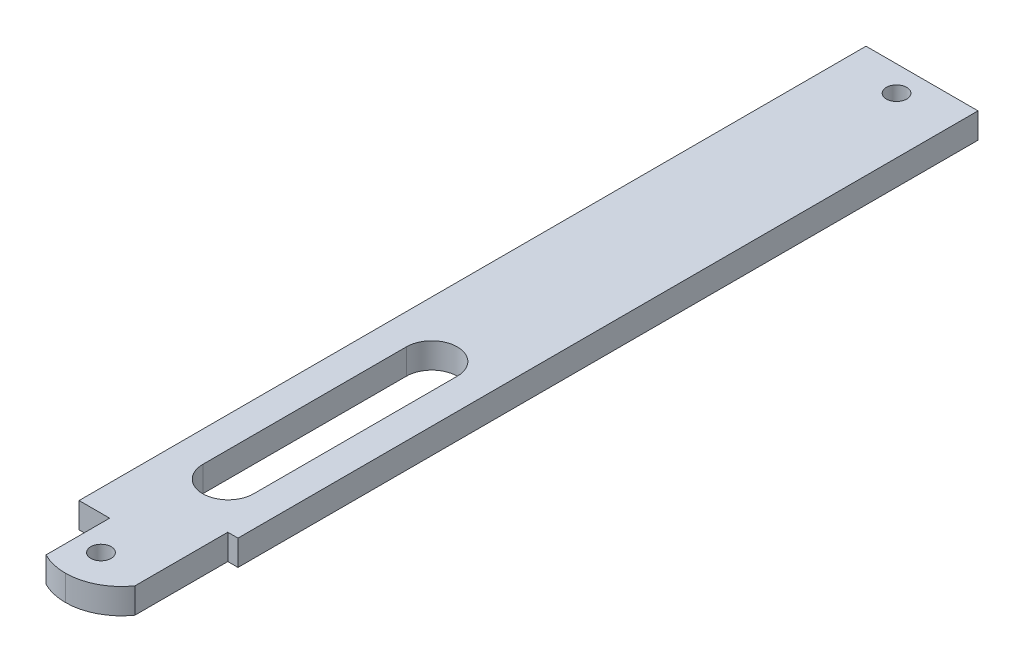
from build123d import *

# Parameters (mm, degrees)
SKETCH1_W           = 22
SKETCH1_H           = 166.3
SKETCH1_R           = 2
BOSS_EXTRUDE1_DEPTH = 5
CUT_EXTRUDE1_DEPTH  = 5
SKETCH3_W           = 22
SKETCH3_H           = 5
BOSS_EXTRUDE2_DEPTH = 6
SKETCH4_W           = 22
SKETCH4_H           = 5
CUT_EXTRUDE2_DEPTH  = 4
FILLET2_R           = 11
SKETCH5_W           = 19.280438378
SKETCH5_H           = 5
CUT_EXTRUDE3_DEPTH  = 6
SKETCH7_W           = 29.371075178
SKETCH7_H           = 5
CUT_EXTRUDE4_DEPTH  = 2


with BuildPart() as part:
    # Sketch1 → Boss-Extrude1 (new body)
    with BuildSketch(Plane(origin=(0, 0, 0), x_dir=(1, 0, 0), z_dir=(0, 1, 0))):
        with Locations((11, 83.15)):
            Rectangle(SKETCH1_W, SKETCH1_H)
        with Locations(Location((11, 5, 0), (0, 0, 270))):
            Circle(SKETCH1_R, mode=Mode.SUBTRACT)
        with Locations(Location((11, 161.3, 0), (0, 0, 270))):
            Circle(SKETCH1_R, mode=Mode.SUBTRACT)
    extrude(amount=BOSS_EXTRUDE1_DEPTH)

    # Sketch2 → Cut-Extrude1 (cut)
    with BuildSketch(Plane(origin=(0, 0, 0), x_dir=(-1, 0, 0), z_dir=(0, -1, 0))):
        with BuildLine():
            Line((-16, 30), (-16, 70))
            ThreePointArc((-16, 70), (-11, 75), (-6, 70))
            Line((-6, 70), (-6, 30))
            ThreePointArc((-6, 30), (-11, 25), (-16, 30))
        make_face()
    extrude(amount=-CUT_EXTRUDE1_DEPTH, mode=Mode.SUBTRACT)

    # Sketch3 → Boss-Extrude2 (add)
    with BuildSketch(Plane.XY):
        with Locations((11, 2.5)):
            Rectangle(SKETCH3_W, SKETCH3_H)
    extrude(amount=BOSS_EXTRUDE2_DEPTH)

    # Sketch4 → Cut-Extrude2 (cut)
    with BuildSketch(Plane.XY.offset(6)):
        with Locations((11, 2.5)):
            Rectangle(SKETCH4_W, SKETCH4_H)
    extrude(amount=-CUT_EXTRUDE2_DEPTH, mode=Mode.SUBTRACT)

    # Fillet2
    fillet2_edges = [part.edges().sort_by_distance(p)[0] for p in [
        (0, 2.5, 2),
        (22, 2.5, 2),
    ]]
    fillet(fillet2_edges, radius=FILLET2_R - 0.0001)  # a hair under: the kernel refuses the full size

    # Sketch5 → Cut-Extrude3 (cut)
    with BuildSketch(Plane.ZY):
        with Locations((-2.059665651, 2.5)):
            Rectangle(SKETCH5_W, SKETCH5_H)
    extrude(amount=-CUT_EXTRUDE3_DEPTH, mode=Mode.SUBTRACT)

    # Sketch7 → Cut-Extrude4 (cut)
    with BuildSketch(Plane(origin=(22, 0, 0), x_dir=(0, 0, -1), z_dir=(1, 0, 0))):
        with Locations((6.231522195, 2.5)):
            Rectangle(SKETCH7_W, SKETCH7_H)
    extrude(amount=-CUT_EXTRUDE4_DEPTH, mode=Mode.SUBTRACT)


solid = part.part
